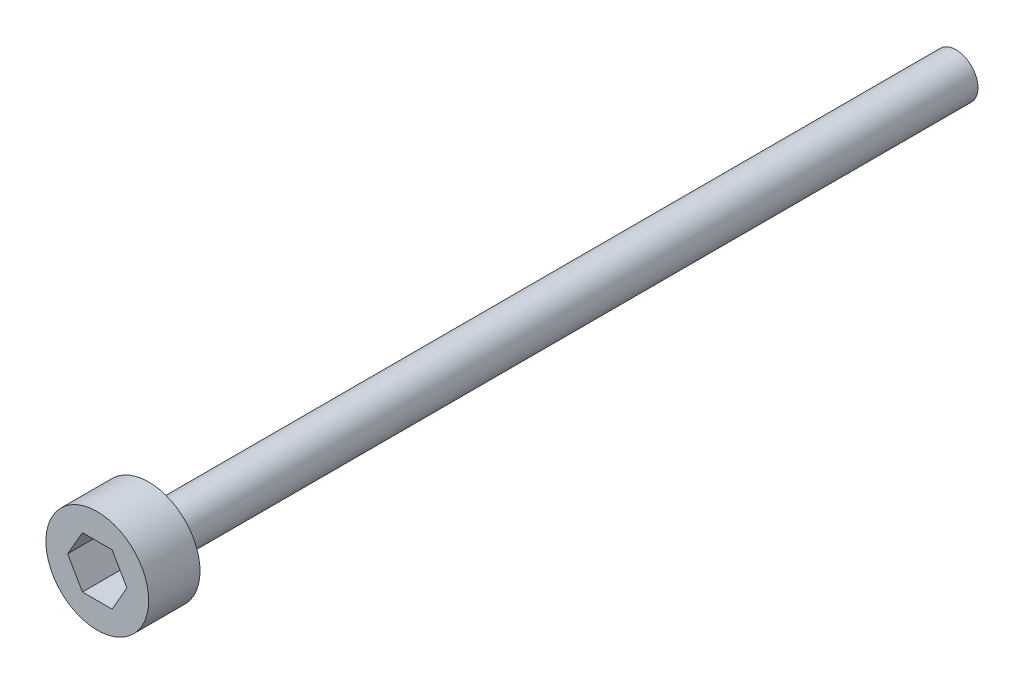
from build123d import *

# Parameters (mm, degrees)
HEAD_BOSS_EXTRUDE1_OUTLINE_R = 3.5
HEAD_BOSS_EXTRUDE1_DEPTH     = 3.5
HEAD_HEX_CUT_EXTRUDE1_DEPTH  = 2.8
SKETCH2_R                    = 1.5
SCREW_BOSS_EXTRUDE2_DEPTH    = 55


# Read off the part's stored shape, not the designer's step: Head Boss-Extrude1
with BuildPart() as part:
    # Head Boss-Extrude1 outline → Head Boss-Extrude1 (new body)
    with BuildSketch(Plane.XY):
        Circle(HEAD_BOSS_EXTRUDE1_OUTLINE_R)
    extrude(amount=HEAD_BOSS_EXTRUDE1_DEPTH)

    # Sketch3 → Head Hex Cut-Extrude1 (cut)
    with BuildSketch(Plane.XY.offset(3.5)):
        Polygon((-1.010362971, 1.75), (1.010362971, 1.75), (2.020725942, 0), (1.010362971, -1.75), (-1.010362971, -1.75), (-2.020725942, 0), align=None)
    extrude(amount=-HEAD_HEX_CUT_EXTRUDE1_DEPTH, mode=Mode.SUBTRACT)

    # Sketch2 → Screw Boss-Extrude2 (add)
    with BuildSketch(Plane.XY):
        Circle(SKETCH2_R)
    extrude(amount=-SCREW_BOSS_EXTRUDE2_DEPTH)


solid = part.part
